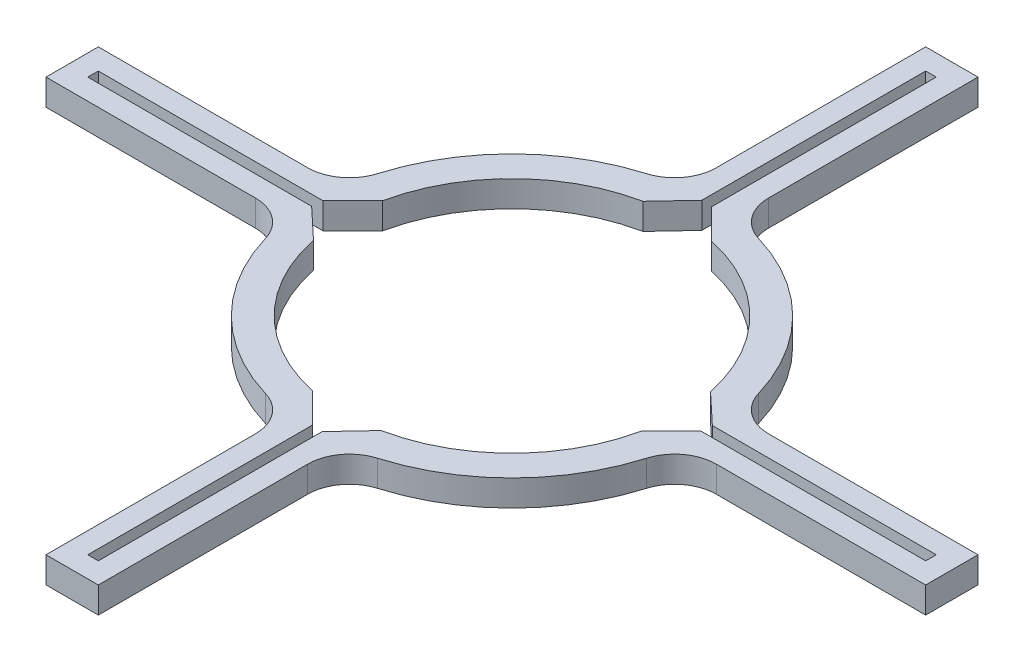
from build123d import *

# Parameters (mm, degrees)
BOSS_EXTRUDE1_DEPTH = 7.9375
FILLET2_R           = 12.7
CHAMFER1_SIZE       = 8.198155848
CHAMFER1_SIZE_2     = 7.9375


with BuildPart() as part:
    # Sketch1 → Boss-Extrude1 (new body)
    with BuildSketch(Plane(origin=(0, 0, 0), x_dir=(1, 0, 0), z_dir=(0, 1, 0))):
        with BuildLine():
            Line((-7.9502, 133.6675), (7.9502, 133.6675))
            Line((7.9502, 133.6675), (7.9502, 59.79882896))
            ThreePointArc((7.9502, 59.79882896), (42.656216575, 42.656216575), (59.79882896, 7.9502))
            Line((59.79882896, 7.9502), (133.6675, 7.9502))
            Line((133.6675, 7.9502), (133.6675, -7.9502))
            Line((133.6675, -7.9502), (59.79882896, -7.9502))
            ThreePointArc((59.79882896, -7.9502), (42.656216575, -42.656216575), (7.9502, -59.79882896))
            Line((7.9502, -59.79882896), (7.9502, -133.6675))
            Line((7.9502, -133.6675), (-7.9502, -133.6675))
            Line((-7.9502, -133.6675), (-7.9502, -59.79882896))
            ThreePointArc((-7.9502, -59.79882896), (-42.656216575, -42.656216575), (-59.79882896, -7.9502))
            Line((-59.79882896, -7.9502), (-133.6675, -7.9502))
            Line((-133.6675, -7.9502), (-133.6675, 7.9502))
            Line((-133.6675, 7.9502), (-59.79882896, 7.9502))
            ThreePointArc((-59.79882896, 7.9502), (-42.656216575, 42.656216575), (-7.9502, 59.79882896))
            Line((-7.9502, 59.79882896), (-7.9502, 133.6675))
        make_face()
        with BuildLine():
            Line((-1.6002, 51.092447252), (-1.6002, 127.3175))
            Line((-1.6002, 127.3175), (1.6002, 127.3175))
            Line((1.6002, 127.3175), (1.6002, 51.092447252))
            ThreePointArc((1.6002, 51.092447252), (36.145530887, 36.145530887), (51.092447252, 1.6002))
            Line((51.092447252, 1.6002), (127.3175, 1.6002))
            Line((127.3175, 1.6002), (127.3175, -1.6002))
            Line((127.3175, -1.6002), (51.092447252, -1.6002))
            ThreePointArc((51.092447252, -1.6002), (36.145530887, -36.145530887), (1.6002, -51.092447252))
            Line((1.6002, -51.092447252), (1.6002, -127.3175))
            Line((1.6002, -127.3175), (-1.6002, -127.3175))
            Line((-1.6002, -127.3175), (-1.6002, -51.092447252))
            ThreePointArc((-1.6002, -51.092447252), (-36.145530887, -36.145530887), (-51.092447252, -1.6002))
            Line((-51.092447252, -1.6002), (-127.3175, -1.6002))
            Line((-127.3175, -1.6002), (-127.3175, 1.6002))
            Line((-127.3175, 1.6002), (-51.092447252, 1.6002))
            ThreePointArc((-51.092447252, 1.6002), (-36.145530887, 36.145530887), (-1.6002, 51.092447252))
        make_face(mode=Mode.SUBTRACT)
    extrude(amount=BOSS_EXTRUDE1_DEPTH)

    # Fillet2
    fillet2_edges = [part.edges().sort_by_distance(p)[0] for p in [
        (59.79882896, 3.96875, 7.9502),
        (7.9502, 3.96875, 59.79882896),
        (-7.9502, 3.96875, 59.79882896),
        (-59.79882896, 3.96875, 7.9502),
        (-59.79882896, 3.96875, -7.9502),
        (-7.9502, 3.96875, -59.79882896),
        (7.9502, 3.96875, -59.79882896),
        (59.79882896, 3.96875, -7.9502),
    ]]
    fillet(fillet2_edges, radius=FILLET2_R)

    # Chamfer1
    # the kernel refuses this chamfer: 8.198155848, 7.9375 mm, written as the material it takes off along each edge
    with BuildSketch(Plane(origin=(-1.6002, -22.411946767, -51.092447252), x_dir=(-0.9932071944131365, 0, 0.11635922381137723), z_dir=(0, 1, 0))) as chamfer1_piece_1:
        with BuildLine():
            Line((8.711494705, 0), (-CHAMFER1_SIZE * 0.116359223814, -CHAMFER1_SIZE * 0.993207194436))
            Line((-CHAMFER1_SIZE * 0.116359223814, -CHAMFER1_SIZE * 0.993207194436), (0, 0))
            ThreePointArc((0, 0), (4.4818633, -0.185760204), (8.711494705, 0))
        make_face()
    extrude(amount=52.761393535, mode=Mode.SUBTRACT)
    with BuildSketch(Plane(origin=(-51.092447252, -23.390114348, -1.6002), x_dir=(0.12010619986132272, 0, -0.9927610491728973), z_dir=(0, 1, 0)), Plane(origin=(-1.6002, -23.390114348, 51.092447252), x_dir=(-0.9927610491728978, 0, -0.12010619986131951), z_dir=(0, 1, 0)), Plane(origin=(51.092447252, -23.390114348, 1.6002), x_dir=(-0.12010619986131572, 0, 0.9927610491728983), z_dir=(0, 1, 0)), Plane(origin=(1.6002, -23.390114348, -51.092447252), x_dir=(0.9927610491728988, 0, 0.12010619986131156), z_dir=(0, 1, 0))) as chamfer1_piece_2:
        with BuildLine():
            Line((9.0958069, 0), (-CHAMFER1_SIZE_2 * 0.120106199861, CHAMFER1_SIZE_2 * 0.992761049173))
            Line((-CHAMFER1_SIZE_2 * 0.120106199861, CHAMFER1_SIZE_2 * 0.992761049173), (0, 0))
            ThreePointArc((0, 0), (4.677699861, 0.202549732), (9.0958069, 0))
        make_face()
    extrude(amount=54.717728697, mode=Mode.SUBTRACT)
    with BuildSketch(Plane(origin=(-51.092447252, -22.411946767, 1.6002), x_dir=(-1, 0, 0), z_dir=(0, 1, 0)), Plane(origin=(1.6002, -22.411946767, 51.092447252), x_dir=(0, 0, 1), z_dir=(0, 1, 0)), Plane(origin=(51.092447252, -22.411946767, -1.6002), x_dir=(1, 0, 0), z_dir=(0, 1, 0))) as chamfer1_piece_3:
        with BuildLine():
            Line((CHAMFER1_SIZE, 0), (-1.013662762, 8.652319215))
            ThreePointArc((-1.013662762, 8.652319215), (-0.337007764, 4.473033787), (0, 0))
            Line((0, 0), (CHAMFER1_SIZE, 0))
        make_face()
    extrude(amount=52.761393535, mode=Mode.SUBTRACT)


solid = part.part
